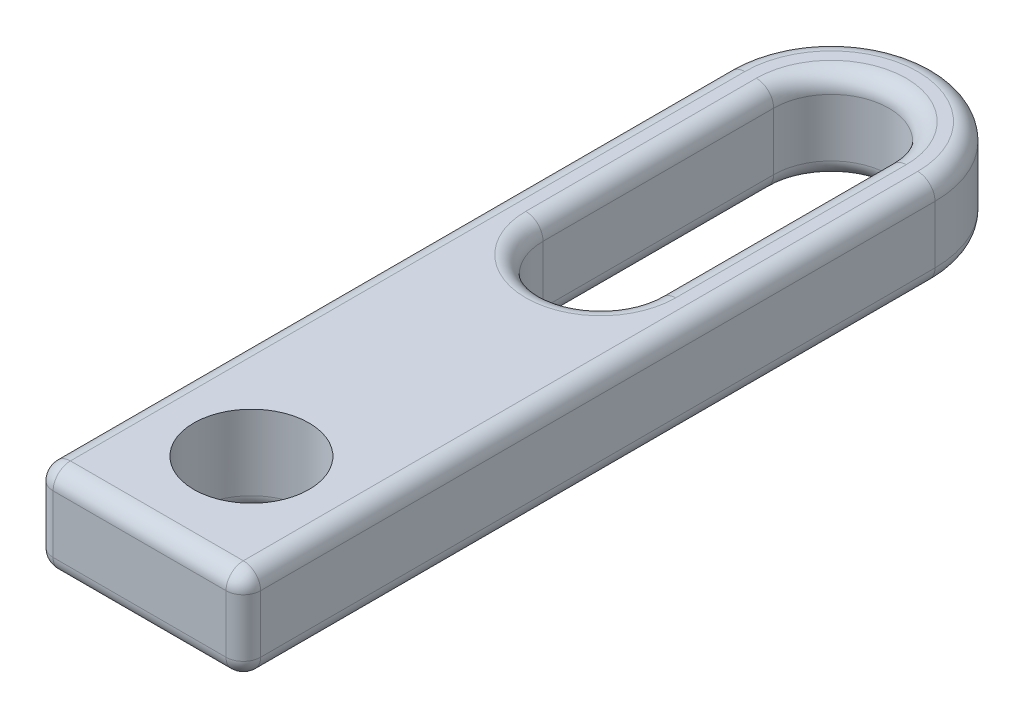
from build123d import *

# Parameters (mm, degrees)
SKETCH1_R           = 2.5
BOSS_EXTRUDE1_DEPTH = 4
FILLET1_R           = 0.75


with BuildPart() as part:
    # Sketch1 → Boss-Extrude1 (new body)
    with BuildSketch(Plane(origin=(0, 0, 0), x_dir=(1, 0, 0), z_dir=(0, 1, 0))):
        with BuildLine():
            Line((-4.5, -17.5), (-4.5, -7.5))
            ThreePointArc((-4.5, -7.5), (0, -3), (4.5, -7.5))
            Line((4.5, -7.5), (4.5, -32.5))
            Line((4.5, -32.5), (4.5, -37.5))
            Line((4.5, -37.5), (-4.5, -37.5))
            Line((-4.5, -37.5), (-4.5, -17.5))
        make_face()
        with Locations((0, -32.64915748)):
            Circle(SKETCH1_R, mode=Mode.SUBTRACT)
        with BuildLine():
            Line((2.5, -7.5), (2.5, -17.5))
            ThreePointArc((2.5, -17.5), (0, -20), (-2.5, -17.5))
            Line((-2.5, -17.5), (-2.5, -7.5))
            ThreePointArc((-2.5, -7.5), (0, -5), (2.5, -7.5))
        make_face(mode=Mode.SUBTRACT)
    extrude(amount=BOSS_EXTRUDE1_DEPTH)

    # Fillet1
    fillet1_edges = [part.edges().sort_by_distance(p)[0] for p in [
        (-4.5, 4, 22.5),
        (-4.5, 2, 37.5),
        (0, 4, 37.5),
        (2.5, 0, 12.5),
        (0, 0, 20),
        (-2.5, 0, 12.5),
        (0, 0, 5),
        (-4.5, 0, 22.5),
        (0, 0, 37.5),
        (0, 4, 3),
        (0, 0, 3),
        (4.5, 2, 37.5),
        (4.5, 4, 22.5),
        (4.5, 0, 22.5),
        (0, 4, 5),
        (2.5, 4, 12.5),
        (0, 4, 20),
        (-2.5, 4, 12.5),
        (-2.5, 0, 32.64915748),
    ]]
    fillet(fillet1_edges, radius=FILLET1_R)


solid = part.part
